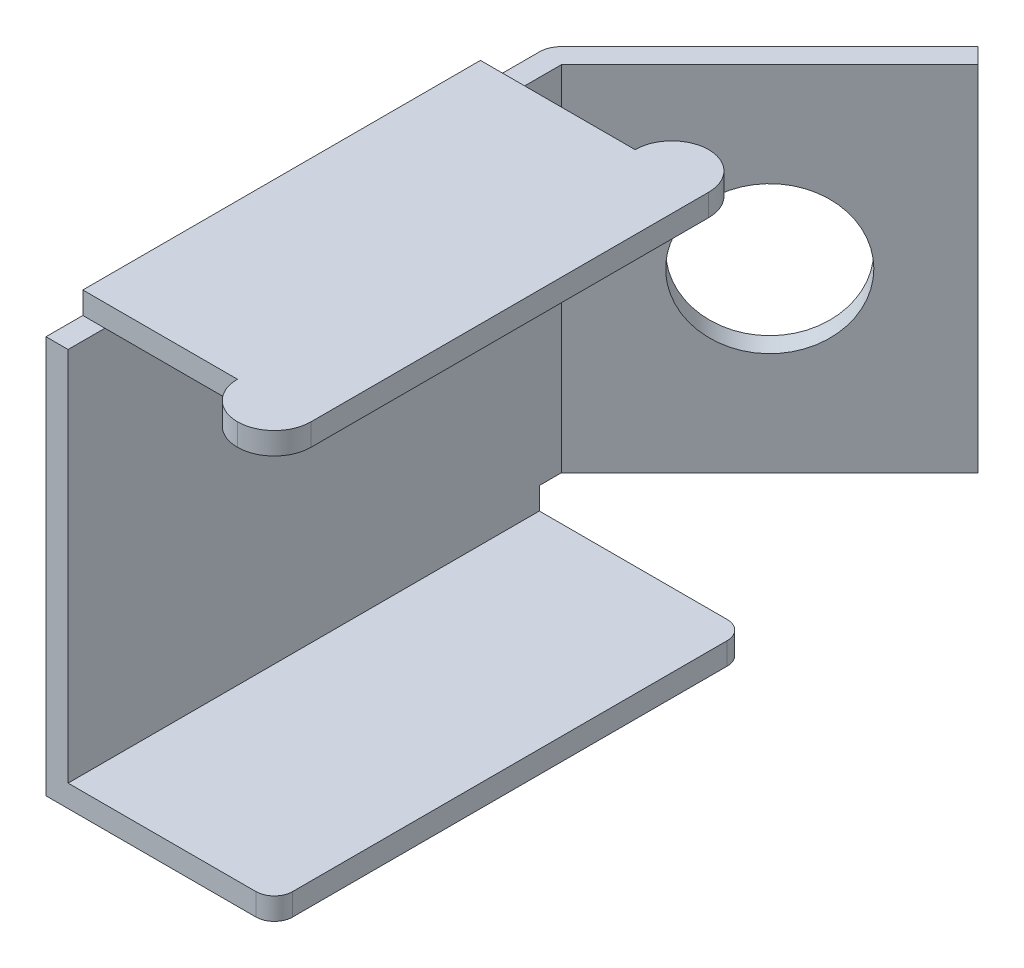
from build123d import *

# Parameters (mm, degrees)
SKETCH1_W           = 1.55
SKETCH1_H           = 3.2
BOSS_EXTRUDE1_DEPTH = 0.15
FILLET1_R           = 0.125
SKETCH2_W           = 0.15
SKETCH2_H           = 3.2
BOSS_EXTRUDE2_DEPTH = 2.55
SKETCH3_W           = 0.15
SKETCH3_H           = 2.4
BOSS_EXTRUDE3_DEPTH = 0.15
BOSS_EXTRUDE4_DEPTH = 2.4
SKETCH5_R           = 0.5
CUT_EXTRUDE1_DEPTH  = 5.356809265
SKETCH6_W           = 1.05
SKETCH6_H           = 2.7
BOSS_EXTRUDE5_DEPTH = 0.15
SKETCH7_W           = 0.5
SKETCH7_H           = 3.2
BOSS_EXTRUDE6_DEPTH = 0.15
FILLET2_R           = 0.25


with BuildPart() as part:
    # Sketch1 → Boss-Extrude1 (new body)
    with BuildSketch(Plane(origin=(0, 0, 0), x_dir=(1, 0, 0), z_dir=(0, 1, 0))):
        with Locations((0.775, 0)):
            Rectangle(SKETCH1_W, SKETCH1_H)
    extrude(amount=BOSS_EXTRUDE1_DEPTH)

    # Fillet1
    fillet1_edges = [part.edges().sort_by_distance(p)[0] for p in [
        (1.55, 0.075, -1.6),
        (1.55, 0.075, 1.6),
    ]]
    fillet(fillet1_edges, radius=FILLET1_R)

    # Sketch2 → Boss-Extrude2 (add)
    with BuildSketch(Plane(origin=(0, 0.15, 0), x_dir=(1, 0, 0), z_dir=(0, 1, 0))):
        with Locations((0.075, 0)):
            Rectangle(SKETCH2_W, SKETCH2_H)
    extrude(amount=BOSS_EXTRUDE2_DEPTH)

    # Sketch3 → Boss-Extrude3 (add)
    with BuildSketch(Plane(origin=(0, 0, -1.6), x_dir=(-1, 0, 0), z_dir=(0, 0, -1))):
        with Locations((-0.075, 1.5)):
            Rectangle(SKETCH3_W, SKETCH3_H)
    extrude(amount=BOSS_EXTRUDE3_DEPTH)

    # Sketch4 → Boss-Extrude4 (add)
    with BuildSketch(Plane(origin=(0, 2.7, 0), x_dir=(1, 0, 0), z_dir=(0, 1, 0))):
        with BuildLine():
            Line((0.15, 1.75), (1.564213562, 3.164213562))
            Line((1.564213562, 3.164213562), (1.458147545, 3.27027958))
            Line((1.458147545, 3.27027958), (0.043933983, 1.856066017))
            ThreePointArc((0.043933983, 1.856066017), (0.01141807, 1.807402515), (0, 1.75))
            Line((0, 1.75), (0.15, 1.75))
        make_face()
    extrude(amount=-BOSS_EXTRUDE4_DEPTH)

    # Sketch5 → Cut-Extrude1 (cut, through all)
    with BuildSketch(Plane(origin=(-0.8, 0, -0.8), x_dir=(0.7071067811865511, 0, -0.7071067811865439), z_dir=(0.7071067811865439, 0, 0.7071067811865511))):
        with Locations((2.343502884, 1.5)):
            Circle(SKETCH5_R)
    extrude(amount=-CUT_EXTRUDE1_DEPTH, mode=Mode.SUBTRACT)

    # Sketch6 → Boss-Extrude5 (add)
    with BuildSketch(Plane(origin=(0, 2.7, 0), x_dir=(1, 0, 0), z_dir=(0, 1, 0))):
        with Locations((0.525, 0)):
            Rectangle(SKETCH6_W, SKETCH6_H)
    extrude(amount=BOSS_EXTRUDE5_DEPTH)

    # Sketch7 → Boss-Extrude6 (add)
    with BuildSketch(Plane(origin=(0, 2.85, 0), x_dir=(1, 0, 0), z_dir=(0, 1, 0))):
        with Locations((1.3, 0)):
            Rectangle(SKETCH7_W, SKETCH7_H)
    extrude(amount=-BOSS_EXTRUDE6_DEPTH)

    # Fillet2
    fillet2_edges = [part.edges().sort_by_distance(p)[0] for p in [
        (1.05, 2.775, -1.6),
        (1.55, 2.775, -1.6),
        (1.05, 2.775, 1.6),
        (1.55, 2.775, 1.6),
    ]]
    fillet(fillet2_edges, radius=FILLET2_R - 0.0001)  # a hair under: the kernel refuses the full size


solid = part.part
